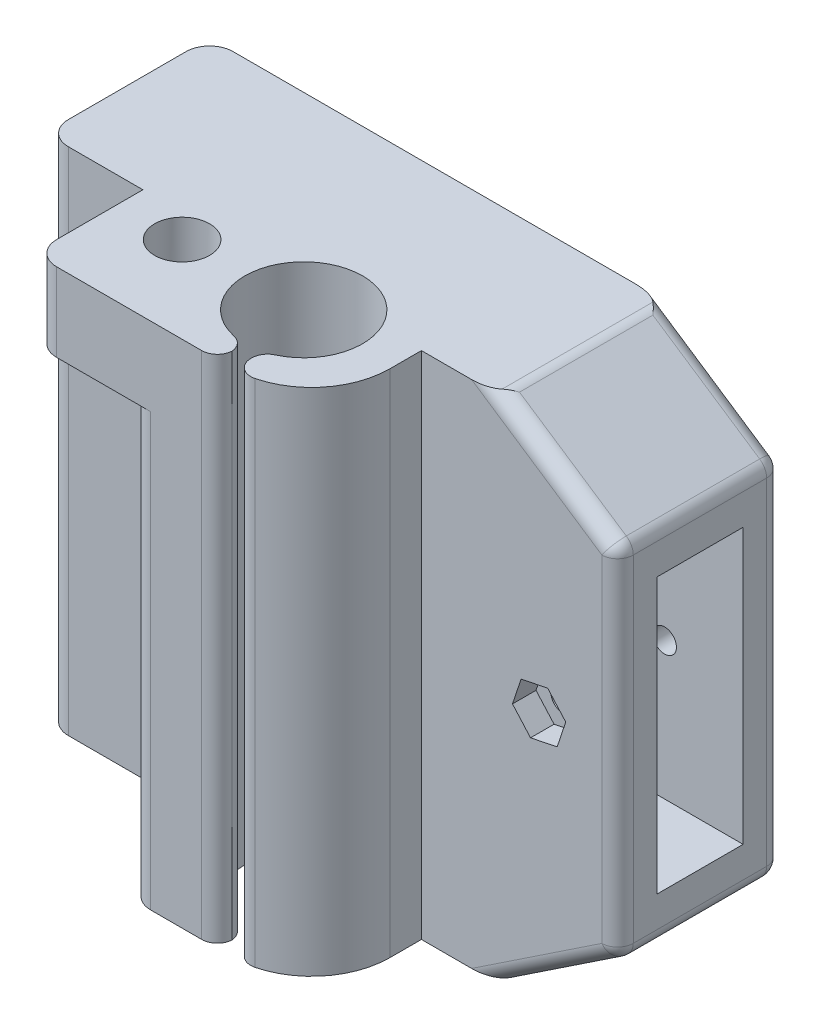
from build123d import *

# Parameters (mm, degrees)
SKETCH1_W           = 48
SKETCH1_H           = 35
BOSS_EXTRUDE1_DEPTH = 65
SKETCH2_R           = 7.5
SKETCH2_R_2         = 3.5
CUT_EXTRUDE1_DEPTH  = 89.056799851
SKETCH3_W           = 14
SKETCH3_H           = 65
CUT_EXTRUDE2_DEPTH  = 12.5
SKETCH4_W           = 14
SKETCH4_H           = 55
CUT_EXTRUDE3_DEPTH  = 12
CUT_EXTRUDE4_DEPTH  = 60
SKETCH6_R           = 7.25
CUT_EXTRUDE5_DEPTH  = 5
SKETCH7_W           = 11
SKETCH7_H           = 35
CUT_EXTRUDE6_DEPTH  = 89.056799851
SKETCH8_R           = 4
CUT_EXTRUDE7_DEPTH  = 30
SKETCH9_W           = 38
SKETCH9_H           = 35
CUT_EXTRUDE8_DEPTH  = 10
FILLET1_R           = 3
SKETCH11_W          = 21
SKETCH11_H          = 65
BOSS_EXTRUDE2_DEPTH = 25
FILLET2_R           = 10
CUT_EXTRUDE9_DEPTH  = 104.821962994
FILLET3_R           = 2
SKETCH13_W          = 11
SKETCH13_H          = 35
CUT_EXTRUDE10_DEPTH = 104.821962994
CUT_EXTRUDE11_DEPTH = 104.821962994
SKETCH16_R          = 1.5
CUT_EXTRUDE13_DEPTH = 104.821962994
CUT_EXTRUDE14_DEPTH = 3
FILLET4_R           = 2


with BuildPart() as part:
    # Sketch1 → Boss-Extrude1 (new body)
    with BuildSketch(Plane(origin=(0, 0, 0), x_dir=(1, 0, 0), z_dir=(0, 1, 0))):
        with Locations((24, 17.5)):
            Rectangle(SKETCH1_W, SKETCH1_H)
    extrude(amount=BOSS_EXTRUDE1_DEPTH)

    # Sketch2 → Cut-Extrude1 (cut, through all)
    with BuildSketch(Plane(origin=(0, 65, 0), x_dir=(1, 0, 0), z_dir=(0, 1, 0))):
        with Locations(Location((36, 11, 0), (0, 0, 270))):
            Circle(SKETCH2_R)
        with Locations(Location((20.5, 11, 0), (0, 0, 270))):
            Circle(SKETCH2_R_2)
    extrude(amount=-CUT_EXTRUDE1_DEPTH, mode=Mode.SUBTRACT)

    # Sketch3 → Cut-Extrude2 (cut)
    with BuildSketch(Plane.ZY):
        with Locations((-7, 32.5)):
            Rectangle(SKETCH3_W, SKETCH3_H)
    extrude(amount=-CUT_EXTRUDE2_DEPTH, mode=Mode.SUBTRACT)

    # Sketch4 → Cut-Extrude3 (cut)
    with BuildSketch(Plane.ZY.offset(-12.5)):
        with Locations((-7, 27.5)):
            Rectangle(SKETCH4_W, SKETCH4_H)
    extrude(amount=-CUT_EXTRUDE3_DEPTH, mode=Mode.SUBTRACT)

    # Sketch5 → Cut-Extrude4 (cut)
    with BuildSketch(Plane.XZ):
        Polygon((25.215019923, -14.528255535), (25.913068886, -8.680800735), (21.198048963, -5.152545199), (15.784980077, -7.471744465), (15.086931114, -13.319199265), (19.801951037, -16.847454801), align=None)
    extrude(amount=-CUT_EXTRUDE4_DEPTH, mode=Mode.SUBTRACT)

    # Sketch6 → Cut-Extrude5 (cut)
    with BuildSketch(Plane(origin=(0, 0, 0), x_dir=(-1, 0, 0), z_dir=(0, -1, 0))):
        with Locations((-20.5, 11)):
            Circle(SKETCH6_R)
    extrude(amount=-CUT_EXTRUDE5_DEPTH, mode=Mode.SUBTRACT)

    # Sketch7 → Cut-Extrude6 (cut, through all)
    with BuildSketch(Plane.ZY):
        with Locations((-24.5, 32.5)):
            Rectangle(SKETCH7_W, SKETCH7_H)
    extrude(amount=-CUT_EXTRUDE6_DEPTH, mode=Mode.SUBTRACT)

    # Sketch8 → Cut-Extrude7 (cut)
    with BuildSketch(Plane.ZY):
        with Locations((-24.5, 58)):
            Circle(SKETCH8_R)
        with Locations((-24.5, 7)):
            Circle(SKETCH8_R)
    extrude(amount=-CUT_EXTRUDE7_DEPTH, mode=Mode.SUBTRACT)

    # Sketch9 → Cut-Extrude8 (cut)
    with BuildSketch(Plane(origin=(0, 0, -35), x_dir=(-1, 0, 0), z_dir=(0, 0, -1))):
        with Locations((-24, 32.5)):
            Rectangle(SKETCH9_W, SKETCH9_H)
    extrude(amount=-CUT_EXTRUDE8_DEPTH, mode=Mode.SUBTRACT)

    # Fillet1
    fillet1_edges = [part.edges().sort_by_distance(p)[0] for p in [
        (0, 32.5, -14),
        (12.5, 60, 0),
        (24.5, 27.5, 0),
        (0, 32.5, -35),
    ]]
    fillet(fillet1_edges, radius=FILLET1_R)

    # Sketch11 → Boss-Extrude2 (add)
    with BuildSketch(Plane(origin=(48, 0, 0), x_dir=(0, 0, -1), z_dir=(1, 0, 0))):
        with Locations((24.5, 32.5)):
            Rectangle(SKETCH11_W, SKETCH11_H)
    extrude(amount=BOSS_EXTRUDE2_DEPTH)

    # Fillet2
    fillet2_edges = [part.edges().sort_by_distance(p)[0] for p in [
        (48, 32.5, 0),
    ]]
    fillet(fillet2_edges, radius=FILLET2_R)

    # Sketch12 → Cut-Extrude9 (cut, through all)
    with BuildSketch(Plane(origin=(0, 65, 0), x_dir=(1, 0, 0), z_dir=(0, 1, 0))):
        Polygon((36, 0), (36, 3.5), (38, 3.771583853), (38, 0), align=None)
    extrude(amount=-CUT_EXTRUDE9_DEPTH, mode=Mode.SUBTRACT)

    # Fillet3
    # the kernel refuses this fillet: 2 mm, written as the material it takes off along each edge
    with BuildSketch(Plane(origin=(38, -6.300214624, 0), x_dir=(0.9920296962671666, 0, -0.12600429248272813), z_dir=(0, 1, 0))) as fillet3_piece_1:
        with BuildLine():
            CenterArc((2.268077265, 1.984059393), FILLET3_R, 172.761243907, 104.477512186)
            Line((0.284017872, 2.236067977), (0, 0))
            ThreePointArc((0, 0), (1.260042925, -0.079703037), (2.52008585, 0))
        make_face()
    extrude(amount=77.600429248, mode=Mode.SUBTRACT)
    with BuildSketch(Plane(origin=(36, 70, 0), x_dir=(-1, 0, 0), z_dir=(0, -1, 0))) as fillet3_piece_2:
        with BuildLine():
            CenterArc((FILLET3_R, FILLET3_R), FILLET3_R, 180, 90)
            Line((0, FILLET3_R), (0, 0))
            Line((0, 0), (FILLET3_R, 0))
        make_face()
    extrude(amount=75, mode=Mode.SUBTRACT)
    with BuildSketch(Plane(origin=(36, 69.467719526, -3.5), x_dir=(0, 0, 1), z_dir=(0, -1, 0))) as fillet3_piece_3:
        with BuildLine():
            CenterArc((1.787087811, 2), FILLET3_R, 192.153197469, 77.846802531)
            ThreePointArc((-0.168088571, 1.578947368), (-0.042140531, 0.793934594), (0, 0))
            Line((0, 0), (1.787087811, 0))
        make_face()
    extrude(amount=73.935439053, mode=Mode.SUBTRACT)
    with BuildSketch(Plane(origin=(38, 68.471069556, -3.771583853), x_dir=(0, 0, 1), z_dir=(0, -1, 0))) as fillet3_piece_4:
        with BuildLine():
            CenterArc((1.388427822, -2), FILLET3_R, 90, 65.09893763)
            ThreePointArc((-0.425644592, -1.157894737), (-0.188974611, -0.587713829), (0, 0))
            Line((0, 0), (1.388427822, 0))
        make_face()
    extrude(amount=71.942139112, mode=Mode.SUBTRACT)

    # Sketch13 → Cut-Extrude10 (cut, through all)
    with BuildSketch(Plane(origin=(73, 0, 0), x_dir=(0, 0, -1), z_dir=(1, 0, 0))):
        with Locations((24.5, 32.5)):
            Rectangle(SKETCH13_W, SKETCH13_H)
    extrude(amount=-CUT_EXTRUDE10_DEPTH, mode=Mode.SUBTRACT)

    # Sketch14 → Cut-Extrude11 (cut, through all)
    with BuildSketch(Plane(origin=(0, 0, -35), x_dir=(-1, 0, 0), z_dir=(0, 0, -1))):
        Polygon((-73, 65), (-58, 65), (-73, 55), align=None)
        Polygon((-73, 0), (-58, 0), (-73, 10), align=None)
    extrude(amount=-CUT_EXTRUDE11_DEPTH, mode=Mode.SUBTRACT)

    # Sketch16 → Cut-Extrude13 (cut, through all)
    with BuildSketch(Plane(origin=(0, 0, -35), x_dir=(-1, 0, 0), z_dir=(0, 0, -1))):
        with Locations((-63, 32.5)):
            Circle(SKETCH16_R)
    extrude(amount=-CUT_EXTRUDE13_DEPTH, mode=Mode.SUBTRACT)

    # Sketch17 → Cut-Extrude14 (cut)
    with BuildSketch(Plane.XY.offset(-14)):
        Polygon((60.700217219, 35.090559623), (59.606618166, 31.8036095), (61.906400947, 29.213049877), (65.299782781, 29.909440377), (66.393381834, 33.1963905), (64.093599053, 35.786950123), align=None)
    extrude(amount=-CUT_EXTRUDE14_DEPTH, mode=Mode.SUBTRACT)

    # Fillet4
    fillet4_edges = [part.edges().sort_by_distance(p)[0] for p in [
        (65.5, 5, -35),
        (65.5, 5, -14),
        (65.5, 60, -35),
        (65.5, 60, -14),
        (73, 32.5, -14),
        (73, 32.5, -35),
        (58, 0, -24.5),
        (73, 10, -24.5),
        (73, 55, -24.5),
        (58, 65, -24.5),
    ]]
    fillet(fillet4_edges, radius=FILLET4_R)


solid = part.part
